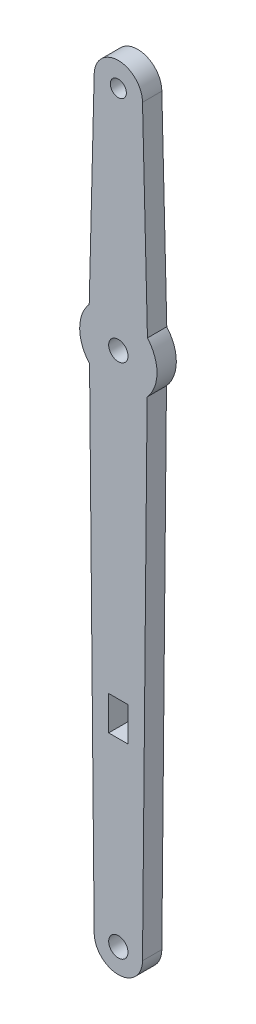
from build123d import *

# Parameters (mm, degrees)
ESQUISSE1_R               = 1.25
ESQUISSE1_R_2             = 1.5
ESQUISSE1_W               = 3
ESQUISSE1_H               = 5.3
T_LE_DE_BASE_PLI_E1_DEPTH = 3


# Sheet-metal steps are written as plain solids
with BuildPart() as part:
    # Esquisse1 → Tôle de base pliée1 (new body)
    with BuildSketch(Plane.XY):
        with BuildLine():
            Line((198.308869227, 952.508921018), (199.076816888, 983.793056947))
            ThreePointArc((199.076816888, 983.793056947), (202.826816888, 987.543056947), (206.576816888, 983.793056947))
            Line((206.576816888, 983.793056947), (207.344764549, 952.508921018))
            ThreePointArc((207.344764549, 952.508921018), (208.826696387, 948.522711746), (207.294357708, 944.555606441))
            Line((207.294357708, 944.555606441), (206.576816888, 868.424415079))
            ThreePointArc((206.576816888, 868.424415079), (202.826816888, 864.674415079), (199.076816888, 868.424415079))
            Line((199.076816888, 868.424415079), (198.360659982, 944.554063284))
            ThreePointArc((198.360659982, 944.554063284), (196.826944047, 948.521675361), (198.308869227, 952.508921018))
        make_face()
        with Locations((202.826816888, 983.793056947)):
            Circle(ESQUISSE1_R, mode=Mode.SUBTRACT)
        with Locations((202.826816888, 948.560738026)):
            Circle(ESQUISSE1_R_2, mode=Mode.SUBTRACT)
        with Locations((202.826816888, 868.424415079)):
            Circle(ESQUISSE1_R_2, mode=Mode.SUBTRACT)
        with Locations((202.826816888, 899.074415079)):
            Rectangle(ESQUISSE1_W, ESQUISSE1_H, mode=Mode.SUBTRACT)
    extrude(amount=-T_LE_DE_BASE_PLI_E1_DEPTH)


solid = part.part
